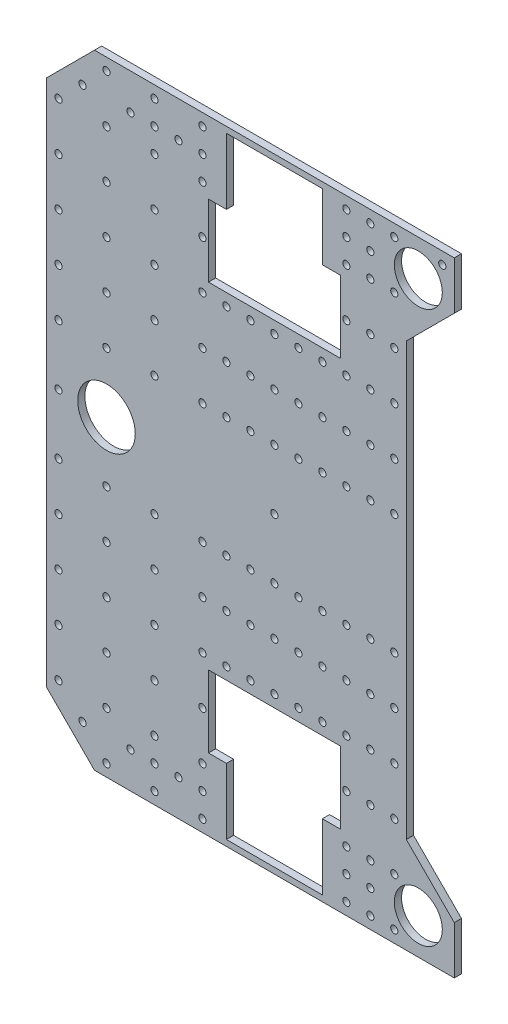
from build123d import *

# Parameters (mm, degrees)
MAIN_DEPTH                    = 3
MOTORCODERLEFTHOLE_DEPTH      = 162.04036761
SKETCH4_R                     = 1.5
BOTTOMLEFTHOLE_DEPTH          = 162.04036761
BOTTOMLEFTHOLELPATTERN_COUNT  = 5
BOTTOMLEFTHOLELPATTERN_PITCH  = 20
SKETCH5_R                     = 1.5
BOTTOMLEFTHOLE2_DEPTH         = 162.04036761
BOTTOMLEFTHOLE2LPATTERN_COUNT = 6
BOTTOMLEFTHOLE2LPATTERN_PITCH = 20
SKETCH6_R                     = 1.5
TOPLEFTHOLE_DEPTH             = 162.04036761
SKETCH7_R                     = 1.5
MOTORFIXHOLES_DEPTH           = 162.04036761
MOTORFIXHOLELPATTERN_COUNT    = 3
MOTORFIXHOLELPATTERN_PITCH    = 20
SKETCH8_R                     = 1.5
CODERHOLE_DEPTH               = 162.04036761
MIRROR1_COPY_1_SKETCH_R       = 1.5
MIRROR1_COPY_1_DEPTH          = 162.04036761
MIRROR1_COPY_2_SKETCH_R       = 1.5
MIRROR1_COPY_2_DEPTH          = 162.04036761
MIRROR1_COPY_3_SKETCH_R       = 1.5
MIRROR1_COPY_3_DEPTH          = 162.04036761
MIRROR1_COPY_4_SKETCH_R       = 1.5
MIRROR1_COPY_4_DEPTH          = 162.04036761
MIRROR1_COPY_5_SKETCH_R       = 1.5
MIRROR1_COPY_5_DEPTH          = 162.04036761
MIRROR1_COPY_6_SKETCH_R       = 1.5
MIRROR1_COPY_6_DEPTH          = 162.04036761
MIRROR1_COPY_7_SKETCH_R       = 1.5
MIRROR1_COPY_7_DEPTH          = 162.04036761
MIRROR1_COPY_8_SKETCH_R       = 1.5
MIRROR1_COPY_8_DEPTH          = 162.04036761
MIRROR1_COPY_9_SKETCH_R       = 1.5
MIRROR1_COPY_9_DEPTH          = 162.04036761
MIRROR1_COPY_10_SKETCH_R      = 1.5
MIRROR1_COPY_10_DEPTH         = 162.04036761
MIRROR1_COPY_11_SKETCH_R      = 1.5
MIRROR1_COPY_11_DEPTH         = 162.04036761
MIRROR1_COPY_12_SKETCH_R      = 1.5
MIRROR1_COPY_12_DEPTH         = 162.04036761
MIRROR1_COPY_13_SKETCH_R      = 1.5
MIRROR1_COPY_13_DEPTH         = 162.04036761
MIRROR1_COPY_14_SKETCH_R      = 1.5
MIRROR1_COPY_14_DEPTH         = 162.04036761
SKETCH3_R                     = 12
SKETCH3_R_2                   = 10
SKETCH3_R_3                   = 1.5
BIGHOLES_DEPTH                = 162.04036761


with BuildPart() as part:
    # Sketch1 → Main (new body)
    with BuildSketch(Plane.XY):
        Polygon((-95, 110), (-95, -110), (-75, -130), (75, -130), (75, -110), (55, -90), (55, 90), (75, 110), (75, 130), (-75, 130), align=None)
    extrude(amount=MAIN_DEPTH)

    # Sketch2 → MotorCoderLeftHole (cut, through all)
    with BuildSketch(Plane.XY.offset(3)):
        Polygon((-27.5, 100), (-27.5, 70), (27.5, 70), (27.5, 100), (20, 100), (20, 127.5), (-20, 127.5), (-20, 100), align=None)
    motorcoderlefthole = extrude(amount=-MOTORCODERLEFTHOLE_DEPTH, mode=Mode.SUBTRACT)

    # Sketch4 → BottomLeftHole (cut, through all)
    with BuildSketch(Plane.XY.offset(3)):
        with Locations((-90, 105)):
            Circle(SKETCH4_R)
    bottomlefthole = extrude(amount=-BOTTOMLEFTHOLE_DEPTH, mode=Mode.SUBTRACT)

    # BottomLeftHoleLPattern: BottomLeftHole ×5
    with Locations(*[(0, -i * BOTTOMLEFTHOLELPATTERN_PITCH, 0) for i in range(1, BOTTOMLEFTHOLELPATTERN_COUNT)]):
        add(bottomlefthole, mode=Mode.SUBTRACT)

    # Sketch5 → BottomLeftHole2 (cut, through all)
    with BuildSketch(Plane.XY.offset(3)):
        with Locations((-70, 125)):
            Circle(SKETCH5_R)
        with Locations((-50, 125)):
            Circle(SKETCH5_R)
        with Locations((-30, 125)):
            Circle(SKETCH5_R)
        with Locations((30, 125)):
            Circle(SKETCH5_R)
        with Locations((50, 125)):
            Circle(SKETCH5_R)
        with Locations((40, 125)):
            Circle(SKETCH5_R)
    bottomlefthole2 = extrude(amount=-BOTTOMLEFTHOLE2_DEPTH, mode=Mode.SUBTRACT)

    # BottomLeftHole2LPattern: BottomLeftHole2 ×6
    with Locations(*[(0, -i * BOTTOMLEFTHOLE2LPATTERN_PITCH, 0) for i in range(1, BOTTOMLEFTHOLE2LPATTERN_COUNT)]):
        add(bottomlefthole2, mode=Mode.SUBTRACT)

    # Sketch6 → TopLeftHole (cut, through all)
    with BuildSketch(Plane.XY.offset(3)):
        with Locations((70, 125)):
            Circle(SKETCH6_R)
    extrude(amount=-TOPLEFTHOLE_DEPTH, mode=Mode.SUBTRACT)

    # Sketch7 → MotorFixHoles (cut, through all)
    with BuildSketch(Plane.XY.offset(3)):
        with Locations((0, 65)):
            Circle(SKETCH7_R)
        with Locations((-10, 65)):
            Circle(SKETCH7_R)
        with Locations((10, 65)):
            Circle(SKETCH7_R)
        with Locations((-20, 65)):
            Circle(SKETCH7_R)
        with Locations((20, 65)):
            Circle(SKETCH7_R)
    motorfixholes = extrude(amount=-MOTORFIXHOLES_DEPTH, mode=Mode.SUBTRACT)

    # MotorFixHoleLPattern: MotorFixHoles ×3
    with Locations(*[(0, -i * MOTORFIXHOLELPATTERN_PITCH, 0) for i in range(1, MOTORFIXHOLELPATTERN_COUNT)]):
        add(motorfixholes, mode=Mode.SUBTRACT)

    # Sketch8 → CoderHole (cut, through all)
    with BuildSketch(Plane.XY.offset(3)):
        with Locations((-80, 115)):
            Circle(SKETCH8_R)
        with Locations((-60, 115)):
            Circle(SKETCH8_R)
        with Locations((60, 115)):
            Circle(SKETCH8_R)
        with Locations((-40, 115)):
            Circle(SKETCH8_R)
        with Locations((40, 115)):
            Circle(SKETCH8_R)
        with Locations((-30, 115)):
            Circle(SKETCH8_R)
        with Locations((-50, 115)):
            Circle(SKETCH8_R)
        with Locations((30, 115)):
            Circle(SKETCH8_R)
    coderhole = extrude(amount=-CODERHOLE_DEPTH, mode=Mode.SUBTRACT)

    # Mirror1: MotorCoderLeftHole, CoderHole across plane
    add(motorcoderlefthole.mirror(Plane.ZX), mode=Mode.SUBTRACT)
    add(coderhole.mirror(Plane.ZX), mode=Mode.SUBTRACT)

    # Mirror1 copy 1 sketch → Mirror1 copy 1 (cut, through all)
    with BuildSketch(Plane(origin=(0, 20, 3), x_dir=(1, 0, 0), z_dir=(0, 0, 1))):
        with Locations((-90, -105)):
            Circle(MIRROR1_COPY_1_SKETCH_R)
    extrude(amount=-MIRROR1_COPY_1_DEPTH, mode=Mode.SUBTRACT)

    # Mirror1 copy 2 sketch → Mirror1 copy 2 (cut, through all)
    with BuildSketch(Plane(origin=(0, 40, 3), x_dir=(1, 0, 0), z_dir=(0, 0, 1))):
        with Locations((-90, -105)):
            Circle(MIRROR1_COPY_2_SKETCH_R)
    extrude(amount=-MIRROR1_COPY_2_DEPTH, mode=Mode.SUBTRACT)

    # Mirror1 copy 3 sketch → Mirror1 copy 3 (cut, through all)
    with BuildSketch(Plane(origin=(0, 60, 3), x_dir=(1, 0, 0), z_dir=(0, 0, 1))):
        with Locations((-90, -105)):
            Circle(MIRROR1_COPY_3_SKETCH_R)
    extrude(amount=-MIRROR1_COPY_3_DEPTH, mode=Mode.SUBTRACT)

    # Mirror1 copy 4 sketch → Mirror1 copy 4 (cut, through all)
    with BuildSketch(Plane(origin=(0, 80, 3), x_dir=(1, 0, 0), z_dir=(0, 0, 1))):
        with Locations((-90, -105)):
            Circle(MIRROR1_COPY_4_SKETCH_R)
    extrude(amount=-MIRROR1_COPY_4_DEPTH, mode=Mode.SUBTRACT)

    # Mirror1 copy 5 sketch → Mirror1 copy 5 (cut, through all)
    with BuildSketch(Plane.XY.offset(3)):
        with Locations((-90, -105)):
            Circle(MIRROR1_COPY_5_SKETCH_R)
    extrude(amount=-MIRROR1_COPY_5_DEPTH, mode=Mode.SUBTRACT)

    # Mirror1 copy 6 sketch → Mirror1 copy 6 (cut, through all)
    with BuildSketch(Plane(origin=(0, 20, 3), x_dir=(1, 0, 0), z_dir=(0, 0, 1))):
        with Locations((-70, -125)):
            Circle(MIRROR1_COPY_6_SKETCH_R)
        with Locations((-50, -125)):
            Circle(MIRROR1_COPY_6_SKETCH_R)
        with Locations((-30, -125)):
            Circle(MIRROR1_COPY_6_SKETCH_R)
        with Locations((30, -125)):
            Circle(MIRROR1_COPY_6_SKETCH_R)
        with Locations((50, -125)):
            Circle(MIRROR1_COPY_6_SKETCH_R)
        with Locations((40, -125)):
            Circle(MIRROR1_COPY_6_SKETCH_R)
    extrude(amount=-MIRROR1_COPY_6_DEPTH, mode=Mode.SUBTRACT)

    # Mirror1 copy 7 sketch → Mirror1 copy 7 (cut, through all)
    with BuildSketch(Plane(origin=(0, 40, 3), x_dir=(1, 0, 0), z_dir=(0, 0, 1))):
        with Locations((-70, -125)):
            Circle(MIRROR1_COPY_7_SKETCH_R)
        with Locations((-50, -125)):
            Circle(MIRROR1_COPY_7_SKETCH_R)
        with Locations((-30, -125)):
            Circle(MIRROR1_COPY_7_SKETCH_R)
        with Locations((30, -125)):
            Circle(MIRROR1_COPY_7_SKETCH_R)
        with Locations((50, -125)):
            Circle(MIRROR1_COPY_7_SKETCH_R)
        with Locations((40, -125)):
            Circle(MIRROR1_COPY_7_SKETCH_R)
    extrude(amount=-MIRROR1_COPY_7_DEPTH, mode=Mode.SUBTRACT)

    # Mirror1 copy 8 sketch → Mirror1 copy 8 (cut, through all)
    with BuildSketch(Plane(origin=(0, 60, 3), x_dir=(1, 0, 0), z_dir=(0, 0, 1))):
        with Locations((-70, -125)):
            Circle(MIRROR1_COPY_8_SKETCH_R)
        with Locations((-50, -125)):
            Circle(MIRROR1_COPY_8_SKETCH_R)
        with Locations((-30, -125)):
            Circle(MIRROR1_COPY_8_SKETCH_R)
        with Locations((30, -125)):
            Circle(MIRROR1_COPY_8_SKETCH_R)
        with Locations((50, -125)):
            Circle(MIRROR1_COPY_8_SKETCH_R)
        with Locations((40, -125)):
            Circle(MIRROR1_COPY_8_SKETCH_R)
    extrude(amount=-MIRROR1_COPY_8_DEPTH, mode=Mode.SUBTRACT)

    # Mirror1 copy 9 sketch → Mirror1 copy 9 (cut, through all)
    with BuildSketch(Plane(origin=(0, 80, 3), x_dir=(1, 0, 0), z_dir=(0, 0, 1))):
        with Locations((-70, -125)):
            Circle(MIRROR1_COPY_9_SKETCH_R)
        with Locations((-50, -125)):
            Circle(MIRROR1_COPY_9_SKETCH_R)
        with Locations((-30, -125)):
            Circle(MIRROR1_COPY_9_SKETCH_R)
        with Locations((30, -125)):
            Circle(MIRROR1_COPY_9_SKETCH_R)
        with Locations((50, -125)):
            Circle(MIRROR1_COPY_9_SKETCH_R)
        with Locations((40, -125)):
            Circle(MIRROR1_COPY_9_SKETCH_R)
    extrude(amount=-MIRROR1_COPY_9_DEPTH, mode=Mode.SUBTRACT)

    # Mirror1 copy 10 sketch → Mirror1 copy 10 (cut, through all)
    with BuildSketch(Plane(origin=(0, 100, 3), x_dir=(1, 0, 0), z_dir=(0, 0, 1))):
        with Locations((-70, -125)):
            Circle(MIRROR1_COPY_10_SKETCH_R)
        with Locations((-50, -125)):
            Circle(MIRROR1_COPY_10_SKETCH_R)
        with Locations((-30, -125)):
            Circle(MIRROR1_COPY_10_SKETCH_R)
        with Locations((30, -125)):
            Circle(MIRROR1_COPY_10_SKETCH_R)
        with Locations((50, -125)):
            Circle(MIRROR1_COPY_10_SKETCH_R)
        with Locations((40, -125)):
            Circle(MIRROR1_COPY_10_SKETCH_R)
    extrude(amount=-MIRROR1_COPY_10_DEPTH, mode=Mode.SUBTRACT)

    # Mirror1 copy 11 sketch → Mirror1 copy 11 (cut, through all)
    with BuildSketch(Plane.XY.offset(3)):
        with Locations((-70, -125)):
            Circle(MIRROR1_COPY_11_SKETCH_R)
        with Locations((-50, -125)):
            Circle(MIRROR1_COPY_11_SKETCH_R)
        with Locations((-30, -125)):
            Circle(MIRROR1_COPY_11_SKETCH_R)
        with Locations((30, -125)):
            Circle(MIRROR1_COPY_11_SKETCH_R)
        with Locations((50, -125)):
            Circle(MIRROR1_COPY_11_SKETCH_R)
        with Locations((40, -125)):
            Circle(MIRROR1_COPY_11_SKETCH_R)
    extrude(amount=-MIRROR1_COPY_11_DEPTH, mode=Mode.SUBTRACT)

    # Mirror1 copy 12 sketch → Mirror1 copy 12 (cut, through all)
    with BuildSketch(Plane(origin=(0, 20, 3), x_dir=(1, 0, 0), z_dir=(0, 0, 1))):
        with Locations((0, -65)):
            Circle(MIRROR1_COPY_12_SKETCH_R)
        with Locations((-10, -65)):
            Circle(MIRROR1_COPY_12_SKETCH_R)
        with Locations((10, -65)):
            Circle(MIRROR1_COPY_12_SKETCH_R)
        with Locations((-20, -65)):
            Circle(MIRROR1_COPY_12_SKETCH_R)
        with Locations((20, -65)):
            Circle(MIRROR1_COPY_12_SKETCH_R)
    extrude(amount=-MIRROR1_COPY_12_DEPTH, mode=Mode.SUBTRACT)

    # Mirror1 copy 13 sketch → Mirror1 copy 13 (cut, through all)
    with BuildSketch(Plane(origin=(0, 40, 3), x_dir=(1, 0, 0), z_dir=(0, 0, 1))):
        with Locations((0, -65)):
            Circle(MIRROR1_COPY_13_SKETCH_R)
        with Locations((-10, -65)):
            Circle(MIRROR1_COPY_13_SKETCH_R)
        with Locations((10, -65)):
            Circle(MIRROR1_COPY_13_SKETCH_R)
        with Locations((-20, -65)):
            Circle(MIRROR1_COPY_13_SKETCH_R)
        with Locations((20, -65)):
            Circle(MIRROR1_COPY_13_SKETCH_R)
    extrude(amount=-MIRROR1_COPY_13_DEPTH, mode=Mode.SUBTRACT)

    # Mirror1 copy 14 sketch → Mirror1 copy 14 (cut, through all)
    with BuildSketch(Plane.XY.offset(3)):
        with Locations((0, -65)):
            Circle(MIRROR1_COPY_14_SKETCH_R)
        with Locations((-10, -65)):
            Circle(MIRROR1_COPY_14_SKETCH_R)
        with Locations((10, -65)):
            Circle(MIRROR1_COPY_14_SKETCH_R)
        with Locations((-20, -65)):
            Circle(MIRROR1_COPY_14_SKETCH_R)
        with Locations((20, -65)):
            Circle(MIRROR1_COPY_14_SKETCH_R)
    extrude(amount=-MIRROR1_COPY_14_DEPTH, mode=Mode.SUBTRACT)

    # Sketch3 → BigHoles (cut, through all)
    with BuildSketch(Plane.XY.offset(3)):
        with Locations((-70, 0)):
            Circle(SKETCH3_R)
        with Locations((60, 115)):
            Circle(SKETCH3_R_2)
        with Locations((60, -115)):
            Circle(SKETCH3_R_2)
        Circle(SKETCH3_R_3)
        with Locations((-90, 0)):
            Circle(SKETCH3_R_3)
    extrude(amount=-BIGHOLES_DEPTH, mode=Mode.SUBTRACT)


solid = part.part
